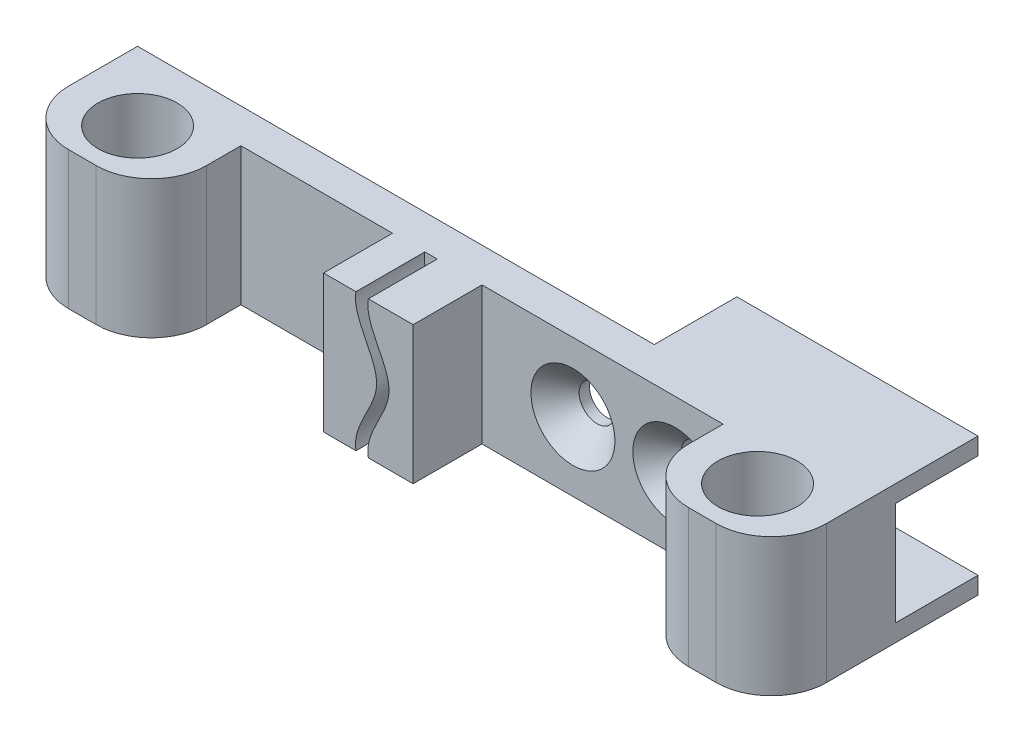
from build123d import *

# Parameters (mm, degrees)
ESQUISSE1_R             = 5.75
BOSS_EXTRU_1_DEPTH      = 20
ESQUISSE2_W             = 35
ESQUISSE2_H             = 2.5
BOSS_EXTRU_2_DEPTH      = 12
ESQUISSE3_R             = 2.6
ENL_V_MAT_EXTRU_1_DEPTH = 22
CHANFREIN1_SIZE         = 3.5
ESQUISSE4_W             = 10
ESQUISSE4_H             = 20
BOSS_EXTRU_3_DEPTH      = 13
ENL_V_MAT_EXTRU_2_DEPTH = 10


with BuildPart() as part:
    # Esquisse1 → Boss.-Extru.1 (new body)
    with BuildSketch(Plane(origin=(0, 0, 0), x_dir=(1, 0, 0), z_dir=(0, 1, 0))):
        with BuildLine():
            Line((47, -18), (43, -18))
            ThreePointArc((43, -18), (37.343145751, -15.656854249), (35, -10))
            Line((35, -10), (35, -5))
            Line((35, -5), (-35, -5))
            Line((-35, -5), (-35, -10))
            ThreePointArc((-35, -10), (-37.343145751, -15.656854249), (-43, -18))
            Line((-43, -18), (-47, -18))
            ThreePointArc((-47, -18), (-52.656854249, -15.656854249), (-55, -10))
            Line((-55, -10), (-55, 0))
            Line((-55, 0), (55, 0))
            Line((55, 0), (55, -10))
            ThreePointArc((55, -10), (52.656854249, -15.656854249), (47, -18))
        make_face()
        with Locations((45, -10)):
            Circle(ESQUISSE1_R, mode=Mode.SUBTRACT)
        with Locations((-45, -10)):
            Circle(ESQUISSE1_R, mode=Mode.SUBTRACT)
    extrude(amount=BOSS_EXTRU_1_DEPTH)

    # Esquisse2 → Boss.-Extru.2 (add)
    with BuildSketch(Plane(origin=(0, 0, 0), x_dir=(-1, 0, 0), z_dir=(0, 0, -1))):
        with Locations((-37.5, 18.75)):
            Rectangle(ESQUISSE2_W, ESQUISSE2_H)
        with Locations((-37.5, 1.25)):
            Rectangle(ESQUISSE2_W, ESQUISSE2_H)
    extrude(amount=BOSS_EXTRU_2_DEPTH)

    # Esquisse3 → Enlèv. mat.-Extru.1 (cut)
    with BuildSketch(Plane(origin=(0, 0, 0), x_dir=(-1, 0, 0), z_dir=(0, 0, -1))):
        with Locations((-13.2, 10)):
            Circle(ESQUISSE3_R)
        with Locations((-28, 10)):
            Circle(ESQUISSE3_R)
    extrude(amount=-ENL_V_MAT_EXTRU_1_DEPTH, mode=Mode.SUBTRACT)

    # Chanfrein1
    chanfrein1_edges = [part.edges().sort_by_distance(p)[0] for p in [
        (30.6, 10, 5),
        (15.8, 10, 5),
    ]]
    chamfer(chanfrein1_edges, length=CHANFREIN1_SIZE)

    # Esquisse4 → Boss.-Extru.3 (add)
    with BuildSketch(Plane(origin=(0, 0, 0), x_dir=(0, 0, -1), z_dir=(1, 0, 0))):
        with Locations((-10, 10)):
            Rectangle(ESQUISSE4_W, ESQUISSE4_H)
    extrude(amount=-BOSS_EXTRU_3_DEPTH)

    # Esquisse7 → Enlèv. mat.-Extru.2 (cut)
    with BuildSketch(Plane.XY.offset(15)):
        with BuildLine():
            Line((-8.3, 20), (-6.5, 20))
            add(Edge.make_bspline(
                [(-6.5, 20), (-7.108972713, 16.589669497), (0.108972713, 10), (-7.108972713, 3.410330503), (-6.5, 0)],
                knots=[0, 0, 0, 0, 0.5, 1, 1, 1, 1], degree=3))
            Line((-6.5, 0), (-8.3, 0))
            add(Edge.make_bspline(
                [(-8.3, 20), (-8.908972713, 16.589669497), (-1.691027287, 10), (-8.908972713, 3.410330503), (-8.3, 0)],
                knots=[0, 0, 0, 0, 0.5, 1, 1, 1, 1], degree=3))
        make_face()
    extrude(amount=-ENL_V_MAT_EXTRU_2_DEPTH, mode=Mode.SUBTRACT)


solid = part.part
